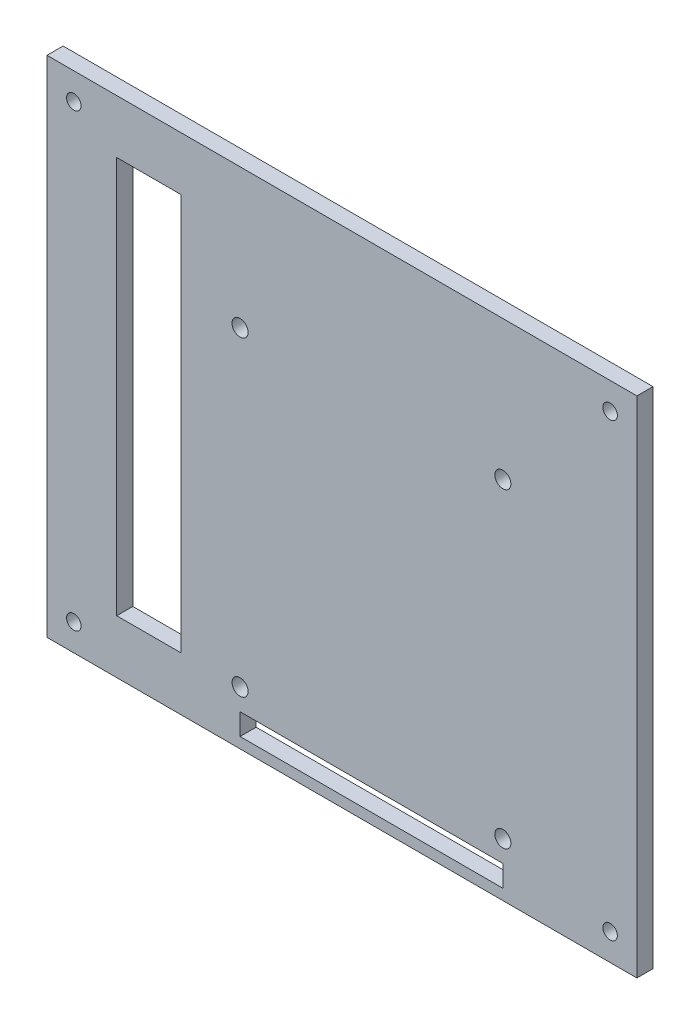
from build123d import *

# Parameters (mm, degrees)
CROQUIS1_W                     = 110
CROQUIS1_H                     = 82
SALIENTE_EXTRUIR1_DEPTH        = 3
CROQUIS7_W                     = 110
CROQUIS7_H                     = 3
SALIENTE_EXTRUIR2_DEPTH        = 6
CROQUIS8_W                     = 110
CROQUIS8_H                     = 3
SALIENTE_EXTRUIR3_DEPTH        = 6
TALADRO_DE_MARGEN_PARA_M2_51_D = 2.7
CORTAR_EXTRUIR2_REACH          = 142.901
CROQUIS13_R                    = 1.5
CORTAR_EXTRUIR3_REACH          = 142.901
CROQUIS14_W                    = 12
CROQUIS14_H                    = 74
CORTAR_EXTRUIR4_REACH          = 142.901
CROQUIS15_W                    = 49
CROQUIS15_H                    = 4


with BuildPart() as part:
    # Croquis1 → Saliente-Extruir1 (new body)
    with BuildSketch(Plane.XY):
        with Locations((55, 41)):
            Rectangle(CROQUIS1_W, CROQUIS1_H)
    extrude(amount=SALIENTE_EXTRUIR1_DEPTH)

    # Croquis7 → Saliente-Extruir2 (add)
    with BuildSketch(Plane(origin=(0, 82, 0), x_dir=(1, 0, 0), z_dir=(0, 1, 0))):
        with Locations((55, -1.5)):
            Rectangle(CROQUIS7_W, CROQUIS7_H)
    extrude(amount=SALIENTE_EXTRUIR2_DEPTH)

    # Croquis8 → Saliente-Extruir3 (add)
    with BuildSketch(Plane.XZ):
        with Locations((55, 1.5)):
            Rectangle(CROQUIS8_W, CROQUIS8_H)
    extrude(amount=SALIENTE_EXTRUIR3_DEPTH)

    # Taladro de margen para M2.51 (through all)
    with Locations(Plane(origin=(5, 83, 3), x_dir=(1, 0, 0), z_dir=(0, 0, 1))):
        with Locations((0, 0), (0, -84), (100, -84), (100, 0)):
            Hole(TALADRO_DE_MARGEN_PARA_M2_51_D / 2)

    # Croquis13 → Cortar-Extruir2 (cut, up to next)
    with BuildSketch(Plane.XY.offset(3), mode=Mode.PRIVATE) as cortar_extruir2_sk1:
        with Locations((36, 62)):
            Circle(CROQUIS13_R)
    cortar_extruir2_tool1 = extrude(cortar_extruir2_sk1.sketch, amount=-CORTAR_EXTRUIR2_REACH, mode=Mode.PRIVATE) & part.part
    # Croquis13 → Cortar-Extruir2 (cut, up to next)
    with BuildSketch(Plane.XY.offset(3), mode=Mode.PRIVATE) as cortar_extruir2_sk2:
        with Locations((85, 62)):
            Circle(CROQUIS13_R)
    cortar_extruir2_tool2 = extrude(cortar_extruir2_sk2.sketch, amount=-CORTAR_EXTRUIR2_REACH, mode=Mode.PRIVATE) & part.part
    # Croquis13 → Cortar-Extruir2 (cut, up to next)
    with BuildSketch(Plane.XY.offset(3), mode=Mode.PRIVATE) as cortar_extruir2_sk3:
        with Locations((36, 4)):
            Circle(CROQUIS13_R)
    cortar_extruir2_tool3 = extrude(cortar_extruir2_sk3.sketch, amount=-CORTAR_EXTRUIR2_REACH, mode=Mode.PRIVATE) & part.part
    # Croquis13 → Cortar-Extruir2 (cut, up to next)
    with BuildSketch(Plane.XY.offset(3), mode=Mode.PRIVATE) as cortar_extruir2_sk4:
        with Locations((85, 4)):
            Circle(CROQUIS13_R)
    cortar_extruir2_tool4 = extrude(cortar_extruir2_sk4.sketch, amount=-CORTAR_EXTRUIR2_REACH, mode=Mode.PRIVATE) & part.part
    add(cortar_extruir2_tool1.solids().sort_by_distance((36, 62, 3))[0], mode=Mode.SUBTRACT)
    add(cortar_extruir2_tool2.solids().sort_by_distance((85, 62, 3))[0], mode=Mode.SUBTRACT)
    add(cortar_extruir2_tool3.solids().sort_by_distance((36, 4, 3))[0], mode=Mode.SUBTRACT)
    add(cortar_extruir2_tool4.solids().sort_by_distance((85, 4, 3))[0], mode=Mode.SUBTRACT)

    # Croquis14 → Cortar-Extruir3 (cut, up to next)
    with BuildSketch(Plane.XY.offset(3), mode=Mode.PRIVATE) as cortar_extruir3_sk1:
        with Locations((19, 41)):
            Rectangle(CROQUIS14_W, CROQUIS14_H)
    cortar_extruir3_tool1 = extrude(cortar_extruir3_sk1.sketch, amount=-CORTAR_EXTRUIR3_REACH, mode=Mode.PRIVATE) & part.part
    add(cortar_extruir3_tool1.solids().sort_by_distance((19, 41, 3))[0], mode=Mode.SUBTRACT)

    # Croquis15 → Cortar-Extruir4 (cut, up to next)
    with BuildSketch(Plane.XY.offset(3), mode=Mode.PRIVATE) as cortar_extruir4_sk1:
        with Locations((60.5, -2)):
            Rectangle(CROQUIS15_W, CROQUIS15_H)
    cortar_extruir4_tool1 = extrude(cortar_extruir4_sk1.sketch, amount=-CORTAR_EXTRUIR4_REACH, mode=Mode.PRIVATE) & part.part
    add(cortar_extruir4_tool1.solids().sort_by_distance((60.5, -2, 3))[0], mode=Mode.SUBTRACT)


solid = part.part
